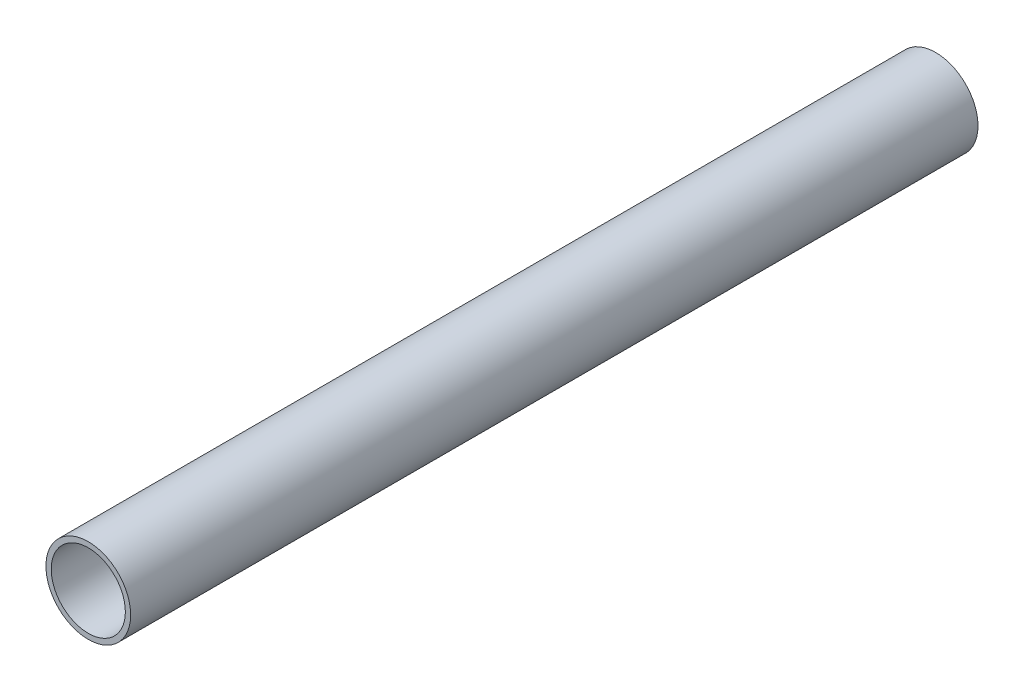
from build123d import *

# Parameters (mm, degrees)
SKETCH2_R           = 12.7
SKETCH2_R_2         = 11.1125
BOSS_EXTRUDE1_DEPTH = 127
SKETCH3_R           = 2.15265
CUT_EXTRUDE1_DEPTH  = 129.263712717


with BuildPart() as part:
    # Sketch2 → Boss-Extrude1 (new, symmetric)
    with BuildSketch(Plane.XY):
        Circle(SKETCH2_R)
        Circle(SKETCH2_R_2, mode=Mode.SUBTRACT)
    extrude(amount=BOSS_EXTRUDE1_DEPTH, both=True)

    # Sketch3 → Cut-Extrude1 (cut, through all)
    with BuildSketch(Plane(origin=(0, 0, 0), x_dir=(1, 0, 0), z_dir=(0, 1, 0))):
        Circle(SKETCH3_R)
    extrude(amount=-CUT_EXTRUDE1_DEPTH, mode=Mode.SUBTRACT)


solid = part.part
